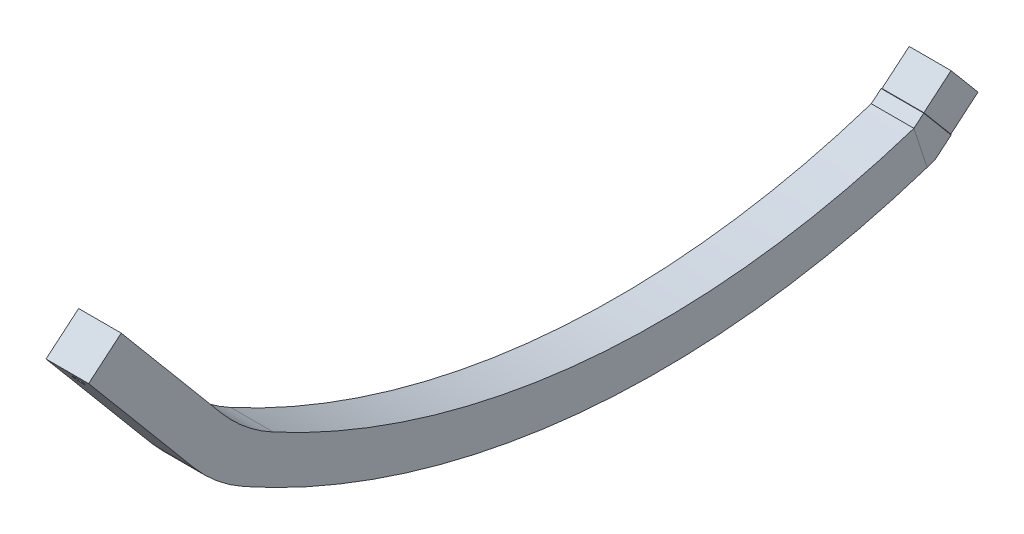
from build123d import *

# Parameters (mm, degrees)
AUFSATZ_LINEAR_AUSTRAGEN1_DEPTH = 12
AUFSATZ_LINEAR_AUSTRAGEN3_DEPTH = 12
AUFSATZ_LINEAR_AUSTRAGEN4_DEPTH = 12
SCHNITT_LINEAR_AUSTRAGEN1_DEPTH = 254.175024926
VERRUNDUNG1_R                   = 50
SKIZZE9_W                       = 12
SKIZZE9_H                       = 12
AUFSATZ_LINEAR_AUSTRAGEN6_DEPTH = 7
SKIZZE10_R                      = 9.036348878
SKIZZE10_W                      = 11.8
SKIZZE10_H                      = 11.8
SCHNITT_LINEAR_AUSTRAGEN3_DEPTH = 10
SKIZZE11_R                      = 1.55
SCHNITT_LINEAR_AUSTRAGEN4_DEPTH = 218.416419828
FASE1_SIZE                      = 0.1


with BuildPart() as part:
    # Skizze1 → Aufsatz-Linear austragen1 (new body)
    with BuildSketch(Plane(origin=(0, 0, 0), x_dir=(0, 0, -1), z_dir=(1, 0, 0))):
        with BuildLine():
            Line((-240, 65), (-230.735708163, 72.773663864))
            ThreePointArc((-230.735708163, 72.773663864), (-123.944567763, 17.242039243), (-3.735818811, 23.403668612))
            Line((-3.735818811, 23.403668612), (0, 12))
            ThreePointArc((0, 12), (-127.247502729, 5.681119716), (-240, 65))
        make_face()
    extrude(amount=AUFSATZ_LINEAR_AUSTRAGEN1_DEPTH)

    # Skizze5 → Aufsatz-Linear austragen4 (add)
    with BuildSketch(Plane(origin=(12, 0, 0), x_dir=(0, 0, -1), z_dir=(1, 0, 0))):
        Polygon((-231.662517154, 71.995978781), (-222.469983836, 79.709430098), (-210.899806862, 65.920630121), (-192.948331238, 44.526894555), (-220.092340179, 58.207178805), align=None)
    extrude(amount=-AUFSATZ_LINEAR_AUSTRAGEN4_DEPTH)

    # Skizze6 → Schnitt-Linear austragen1 (cut, through all)
    with BuildSketch(Plane(origin=(12, 0, 0), x_dir=(0, 0, -1), z_dir=(1, 0, 0))):
        Polygon((-231.662517154, 71.995978781), (-199.510648028, 33.678873242), (-204.367668784, 29.603348917), (-240, 65), align=None)
    extrude(amount=-SCHNITT_LINEAR_AUSTRAGEN1_DEPTH, mode=Mode.SUBTRACT)

    # Verrundung1
    verrundung1_edges = [part.edges().sort_by_distance(p)[0] for p in [
        (6, 44.526894555, 192.948331238),
        (6, 35.285406895, 200.858689823),
    ]]
    fillet(verrundung1_edges, radius=VERRUNDUNG1_R)

    # Skizze9 → Aufsatz-Linear austragen6 (add)
    with BuildSketch(Plane(origin=(0, 156.320496136, 131.168470653), x_dir=(1, 0, 0), z_dir=(0, 0.7660444431189836, 0.6427876096865328))):
        with Locations((6, -125.185660837)):
            Rectangle(SKIZZE9_W, SKIZZE9_H)
    extrude(amount=AUFSATZ_LINEAR_AUSTRAGEN6_DEPTH)

    # Skizze11 → Schnitt-Linear austragen4 (cut, through all)
    with BuildSketch(Plane(origin=(0, -76.611066038, 91.301513183), x_dir=(-1, 0, 0), z_dir=(0, 0.6427876096865329, -0.7660444431189836))):
        with Locations(Location((-6, 206.061915128, 0), (0, 0, 90))):
            Circle(SKIZZE11_R)
    extrude(amount=-SCHNITT_LINEAR_AUSTRAGEN4_DEPTH, mode=Mode.SUBTRACT)


with BuildPart() as body_2:
    # Skizze4 → Aufsatz-Linear austragen3 (new body)
    with BuildSketch(Plane(origin=(0, 0, 0), x_dir=(0, 0, -1), z_dir=(1, 0, 0))):
        with BuildLine():
            Line((-3.735818811, 23.403668612), (6.769031275, 32.218284445))
            Line((6.769031275, 32.218284445), (14.482482591, 23.025751128))
            Line((14.482482591, 23.025751128), (2.225771501, 12.741149373))
            ThreePointArc((2.225771501, 12.741149373), (1.113785782, 12.367871772), (0, 12))
            Line((0, 12), (-3.735818811, 23.403668612))
        make_face()
    extrude(amount=AUFSATZ_LINEAR_AUSTRAGEN3_DEPTH)

    # Skizze10 → Schnitt-Linear austragen3 (cut)
    with BuildSketch(Plane(origin=(0, 16.644916272, -19.836638765), x_dir=(-1, 0, 0), z_dir=(0, 0.6427876096865353, -0.7660444431189815))):
        with Locations((-6, 14.329588333)):
            Circle(SKIZZE10_R)
        with Locations((-6, 14.329588333)):
            Rectangle(SKIZZE10_W, SKIZZE10_H, mode=Mode.SUBTRACT)
    extrude(amount=-SCHNITT_LINEAR_AUSTRAGEN3_DEPTH, mode=Mode.SUBTRACT)

    # Fase1
    fase1_edges = [body_2.edges().sort_by_distance(p)[0] for p in [
        (0, 21.194141689, -2.965312502),
        (6, 16.597875031, -6.82203816),
        (6, 25.790408348, 0.891413156),
        (12, 21.194141689, -2.965312502),
    ]]
    chamfer(fase1_edges, length=FASE1_SIZE - 0.0001)  # a hair under: the kernel refuses the full size


solid = Compound([part.part, body_2.part])
